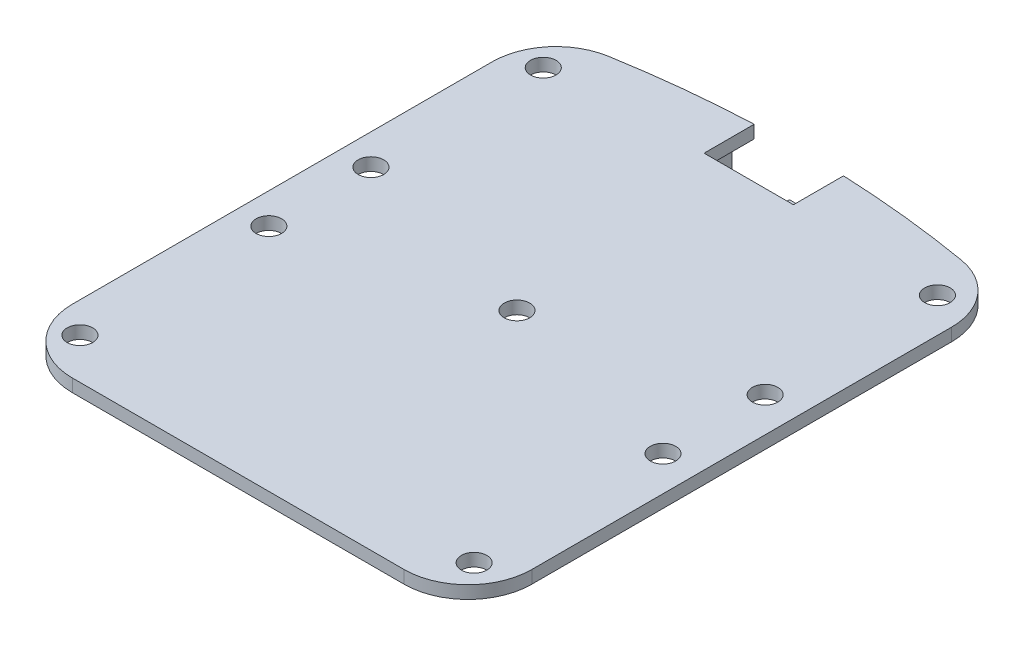
from build123d import *

# Parameters (mm, degrees)
BOSS_EXTRUDE1_DEPTH = 5
SKETCH5_R           = 5
CUT_EXTRUDE2_DEPTH  = 10
SKETCH6_W           = 80
SKETCH6_H           = 80
SKETCH6_W_2         = 95
SKETCH6_H_2         = 95
BOSS_EXTRUDE2_DEPTH = 1
SKETCH7_W           = 35
SKETCH7_H           = 31.403173323
CUT_EXTRUDE3_DEPTH  = 10
SKETCH8_W           = 5.194456784
SKETCH8_H           = 41.458128948
SKETCH8_W_2         = 10.850181862
SKETCH8_H_2         = 36.67307011
BOSS_EXTRUDE3_DEPTH = 44
SKETCH10_R          = 1.688706948
BOSS_EXTRUDE4_DEPTH = 30


with BuildPart() as part:
    # Sketch1 → Boss-Extrude1 (new body)
    with BuildSketch(Plane(origin=(0, 0, 0), x_dir=(1, 0, 0), z_dir=(0, 1, 0))):
        with BuildLine():
            ThreePointArc((-89.202352286, -85), (-81.880021816, -102.67766953), (-64.202352286, -110))
            Line((-64.202352286, -110), (65.797647714, -110))
            ThreePointArc((65.797647714, -110), (83.475317244, -102.67766953), (90.797647714, -85))
            Line((90.797647714, -85), (90.797647714, -35))
            Line((90.797647714, -35), (90.797647714, 31.47331922))
            Line((90.797647714, 31.47331922), (90.797647714, 79.461679372))
            ThreePointArc((90.797647714, 79.461679372), (84.910138891, 95.577283021), (70.020633234, 104.102425978))
            ThreePointArc((70.020633234, 104.102425978), (0.80038099, 109.994179998), (-68.420925207, 104.11482166))
            ThreePointArc((-68.420925207, 104.11482166), (-83.313400439, 95.590634086), (-89.202352286, 79.47331922))
            Line((-89.202352286, 79.47331922), (-89.202352286, 31.47331922))
            Line((-89.202352286, 31.47331922), (-89.202352286, -35))
            Line((-89.202352286, -35), (-89.202352286, -85))
        make_face()
    extrude(amount=BOSS_EXTRUDE1_DEPTH)

    # Sketch5 → Cut-Extrude2 (cut)
    with BuildSketch(Plane(origin=(0, 5, 0), x_dir=(1, 0, 0), z_dir=(0, 1, 0))):
        with Locations((-77.202352286, 20)):
            Circle(SKETCH5_R)
        with Locations((-77.202352286, -20)):
            Circle(SKETCH5_R)
        with Locations((-77.202352286, 87.5)):
            Circle(SKETCH5_R)
        with Locations((-77.202352286, -94)):
            Circle(SKETCH5_R)
        Circle(SKETCH5_R)
        with Locations((77.202352286, -94)):
            Circle(SKETCH5_R)
        with Locations((77.202352286, -20)):
            Circle(SKETCH5_R)
        with Locations((77.202352286, 20)):
            Circle(SKETCH5_R)
        with Locations((77.202352286, 87.5)):
            Circle(SKETCH5_R)
    extrude(amount=-CUT_EXTRUDE2_DEPTH, mode=Mode.SUBTRACT)

    # Sketch6 → Boss-Extrude2 (add)
    with BuildSketch(Plane.XZ):
        with Locations((0, -50)):
            Rectangle(SKETCH6_W, SKETCH6_H)
        with Locations((0, 60)):
            Rectangle(SKETCH6_W_2, SKETCH6_H_2)
    extrude(amount=BOSS_EXTRUDE2_DEPTH)

    # Sketch7 → Cut-Extrude3 (cut)
    with BuildSketch(Plane.XZ):
        with Locations((0.80038099, -105.701586662)):
            Rectangle(SKETCH7_W, SKETCH7_H)
    extrude(amount=-CUT_EXTRUDE3_DEPTH, mode=Mode.SUBTRACT)

    # Sketch8 → Boss-Extrude3 (add)
    with BuildSketch(Plane(origin=(0, 0, 0), x_dir=(-1, 0, 0), z_dir=(0, -1, 0))):
        with Locations((20.738942884, 81.657300766)):
            Rectangle(SKETCH8_W, SKETCH8_H)
        with Locations((-16.214620917, 77.593282846)):
            Rectangle(SKETCH8_W_2, SKETCH8_H_2)
    extrude(amount=BOSS_EXTRUDE3_DEPTH)

    # Sketch10 → Boss-Extrude4 (add)
    with BuildSketch(Plane.ZY.offset(-10.789529986)):
        with Locations((-82.931766483, -23.455304076)):
            Circle(SKETCH10_R)
    extrude(amount=BOSS_EXTRUDE4_DEPTH)


solid = part.part
